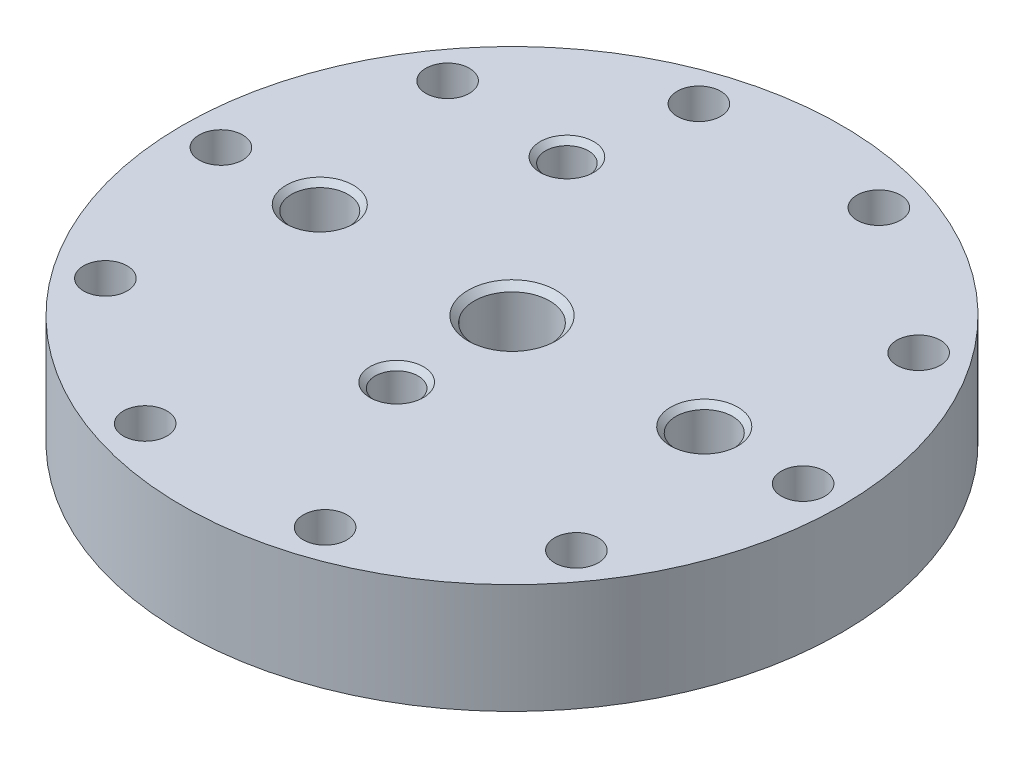
from build123d import *

# Parameters (mm, degrees)
F_3_4_16_TAPPED_HOLE1_D            = 17.4625
F_3_4_16_TAPPED_HOLE1_CSINK_D      = 20.32
F_3_4_16_TAPPED_HOLE1_CSINK_ANGLE  = 90
F_9_16_18_TAPPED_HOLE1_D           = 13.09624
F_9_16_18_TAPPED_HOLE1_CSINK_D     = 15.5575
F_9_16_18_TAPPED_HOLE1_CSINK_ANGLE = 90
F_3_8_CLEARANCE_HOLE2_D            = 10.0838
CIRPATTERN1_COUNT                  = 10
SKETCH15_R                         = 3.175
CUT_EXTRUDE1_DEPTH                 = 12.7
F_7_16_20_TAPPED_HOLE1_D           = 9.92124
F_7_16_20_TAPPED_HOLE1_DEPTH       = 14.799358796
F_7_16_20_TAPPED_HOLE1_CSINK_D     = 12.3825
F_7_16_20_TAPPED_HOLE1_CSINK_ANGLE = 90
F_7_16_20_TAPPED_HOLE1_TIP         = 2.980641204
F_7_16_20_TAPPED_HOLE2_D           = 9.92124
F_7_16_20_TAPPED_HOLE2_CSINK_D     = 12.3825
F_7_16_20_TAPPED_HOLE2_CSINK_ANGLE = 90


with BuildPart() as part:
    # Sketch1 → Revolve1 (revolve)
    with BuildSketch(Plane.XY):
        Polygon((0, 0), (-76.2, 0), (-76.2, -25.4), (-58.8899, -25.4), (-58.8899, -22.7076), (-54.8259, -22.7076), (-54.8259, -25.4), (-36.6649, -25.4), (-36.6649, -22.7076), (-32.6009, -22.7076), (-32.6009, -25.4), (-31.0134, -25.4), (0, -12.7), align=None)
    revolve(axis=Axis((0, 0, 0), (0, -1, 0)))

    # 3/4-16 Tapped Hole1 (through all)
    with Locations(Plane(origin=(0, 0, 0), x_dir=(1, 0, 0), z_dir=(0, 1, 0))):
        with Locations((0, 0)):
            CounterSinkHole(F_3_4_16_TAPPED_HOLE1_D / 2, F_3_4_16_TAPPED_HOLE1_CSINK_D / 2, counter_sink_angle=F_3_4_16_TAPPED_HOLE1_CSINK_ANGLE)

    # 9/16-18 Tapped Hole1 (through all)
    with Locations(Plane(origin=(0, 0, 0), x_dir=(1, 0, 0), z_dir=(0, 1, 0))):
        with Locations((-44.45, 0), (44.45, 0)):
            CounterSinkHole(F_9_16_18_TAPPED_HOLE1_D / 2, F_9_16_18_TAPPED_HOLE1_CSINK_D / 2, counter_sink_angle=F_9_16_18_TAPPED_HOLE1_CSINK_ANGLE)

    # 3/8 Clearance Hole2 (through all)
    with Locations(Plane(origin=(67.31, 0, 0), x_dir=(1, 0, 0), z_dir=(0, 1, 0))):
        with Locations((0, 0)):
            f_3_8_clearance_hole2 = Hole(F_3_8_CLEARANCE_HOLE2_D / 2)

    # CirPattern1: 3/8 Clearance Hole2 ×10 about axis
    cirpattern1_axis = Axis((0, 0, 0), (0, 1, 0))
    for i in range(1, CIRPATTERN1_COUNT):
        add(f_3_8_clearance_hole2.rotate(cirpattern1_axis, i * 360 / CIRPATTERN1_COUNT), mode=Mode.SUBTRACT)

    # Sketch15 → Cut-Extrude1 (cut, symmetric)
    with BuildSketch(Plane(origin=(0, -2.71901118, -2.71901118), x_dir=(0, 0.7071067811865489, -0.7071067811865462), z_dir=(0, -0.7071067811865462, -0.7071067811865489))):
        with Locations((-27.975262487, 0)):
            Circle(SKETCH15_R)
    extrude(amount=CUT_EXTRUDE1_DEPTH, both=True, mode=Mode.SUBTRACT)

    # 7/16-20 Tapped Hole1
    with Locations(Plane(origin=(0, 0, 26.67), x_dir=(1, 0, 0), z_dir=(0, 1, 0))):
        with Locations((0, 0)):
            CounterSinkHole(F_7_16_20_TAPPED_HOLE1_D / 2, F_7_16_20_TAPPED_HOLE1_CSINK_D / 2, depth=F_7_16_20_TAPPED_HOLE1_DEPTH, counter_sink_angle=F_7_16_20_TAPPED_HOLE1_CSINK_ANGLE)
            with Locations((0, 0, -(F_7_16_20_TAPPED_HOLE1_DEPTH + F_7_16_20_TAPPED_HOLE1_TIP / 2))):  # 118° drill point
                Cone(0, F_7_16_20_TAPPED_HOLE1_D / 2, F_7_16_20_TAPPED_HOLE1_TIP, mode=Mode.SUBTRACT)

    # 7/16-20 Tapped Hole2 (through all)
    with Locations(Plane(origin=(-25.4, 0, -38.1), x_dir=(1, 0, 0), z_dir=(0, 1, 0))):
        with Locations((0, 0)):
            CounterSinkHole(F_7_16_20_TAPPED_HOLE2_D / 2, F_7_16_20_TAPPED_HOLE2_CSINK_D / 2, counter_sink_angle=F_7_16_20_TAPPED_HOLE2_CSINK_ANGLE)


solid = part.part
